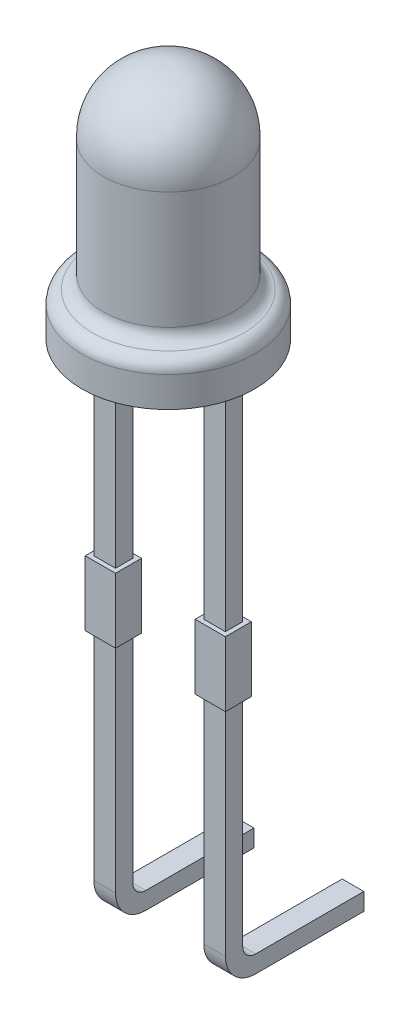
from build123d import *

# Parameters (mm, degrees)
FILLET_1_R      = 0.3
FILLET_2_R      = 0.3
SKETCH_2_W      = 0.5
SKETCH_2_H      = 0.4
EXTRUDE_1_DEPTH = 5
SKETCH_3_W      = 0.7
SKETCH_3_H      = 0.6
EXTRUDE_2_DEPTH = 1.5
SKETCH_5_W      = 0.5
SKETCH_5_H      = 0.4
EXTRUDE_3_DEPTH = 4.5
SWEEP_START     = -1.52
SWEEP_2_DEPTH   = 0.5
SKETCH_7_262_W  = 0.5
SKETCH_7_262_H  = 0.4


# Read off the part's stored shape, not the designer's step: По траектории2
with BuildPart() as part:
    # Эскиз1 → Повернуть2 (revolve)
    with BuildSketch(Plane(origin=(0, 0, 0), x_dir=(0, 0, -1), z_dir=(1, 0, 0))):
        with BuildLine():
            Line((0, 0), (-2, 0))
            Line((-2, 0), (-2, 1))
            Line((-2, 1), (-1.5, 1))
            Line((-1.5, 1), (-1.5, 4))
            ThreePointArc((-1.5, 4), (-1.07971355, 5.07971355), (0, 5.5))
            Line((0, 5.5), (0, 0))
        make_face()
    revolve(axis=Axis((0, 5.5, 0), (0, -1, 0)))

    # Скругление1
    fillet_1_edges = [part.edges().sort_by_distance(p)[0] for p in [
        (0, 1, -2),
    ]]
    fillet(fillet_1_edges, radius=FILLET_1_R)

    # Скругление2
    fillet_2_edges = [part.edges().sort_by_distance(p)[0] for p in [
        (0, 1, -1.5),
    ]]
    fillet(fillet_2_edges, radius=FILLET_2_R)

    # Эскиз2 → Вытянуть1 (add)
    with BuildSketch(Plane.XZ):
        with Locations((-1.27, 0)):
            Rectangle(SKETCH_2_W, SKETCH_2_H)
        with Locations((1.27, 0)):
            Rectangle(SKETCH_2_W, SKETCH_2_H)
    extrude(amount=EXTRUDE_1_DEPTH)

    # Эскиз3 → Вытянуть2 (add)
    with BuildSketch(Plane.XZ.offset(5)):
        with Locations((-1.27, 0)):
            Rectangle(SKETCH_3_W, SKETCH_3_H)
        with Locations((1.27, 0)):
            Rectangle(SKETCH_3_W, SKETCH_3_H)
    extrude(amount=EXTRUDE_2_DEPTH)

    # Эскиз5 → Вытянуть3 (add)
    with BuildSketch(Plane.XZ.offset(6.5)):
        with Locations((-1.27, 0)):
            Rectangle(SKETCH_5_W, SKETCH_5_H)
        with Locations((1.27, 0)):
            Rectangle(SKETCH_5_W, SKETCH_5_H)
    extrude(amount=EXTRUDE_3_DEPTH)

    # По траектории2 outline → По траектории2 (add)
    with BuildSketch(Plane.YZ.offset(SWEEP_START)):
        with BuildLine():
            Line((-11.5, -0.2), (-11, -0.2))
            Line((-11, -0.2), (-11, 0.2))
            Line((-11, 0.2), (-11.5, 0.2))
            ThreePointArc((-11.5, 0.2), (-11.994974747, -0.005025253), (-12.2, -0.5))
            Line((-12.2, -0.5), (-12.2, -3))
            Line((-12.2, -3), (-11.8, -3))
            Line((-11.8, -3), (-11.8, -0.5))
            ThreePointArc((-11.8, -0.5), (-11.712132034, -0.287867966), (-11.5, -0.2))
        make_face()
    extrude(amount=SWEEP_2_DEPTH)

    # По траектории11: sweep along a curve in space
    with BuildLine() as sweep_11_path:
        Line((-1.27, -11, 0), (-1.27, -11.5, 0))
        ThreePointArc((-1.27, -11.5, 0), (-1.27, -11.853553391, -0.146446609), (-1.27, -12, -0.5))
        Line((-1.27, -12, -0.5), (-1.27, -12, -3))
    # Эскиз7<262> → По траектории11 (sweep)
    with BuildSketch(Plane.XZ.offset(11)):
        with Locations((-1.27, 0)):
            Rectangle(SKETCH_7_262_W, SKETCH_7_262_H)
        with Locations((1.27, 0)):
            Rectangle(SKETCH_7_262_W, SKETCH_7_262_H)
    sweep(path=sweep_11_path.line)


solid = part.part
